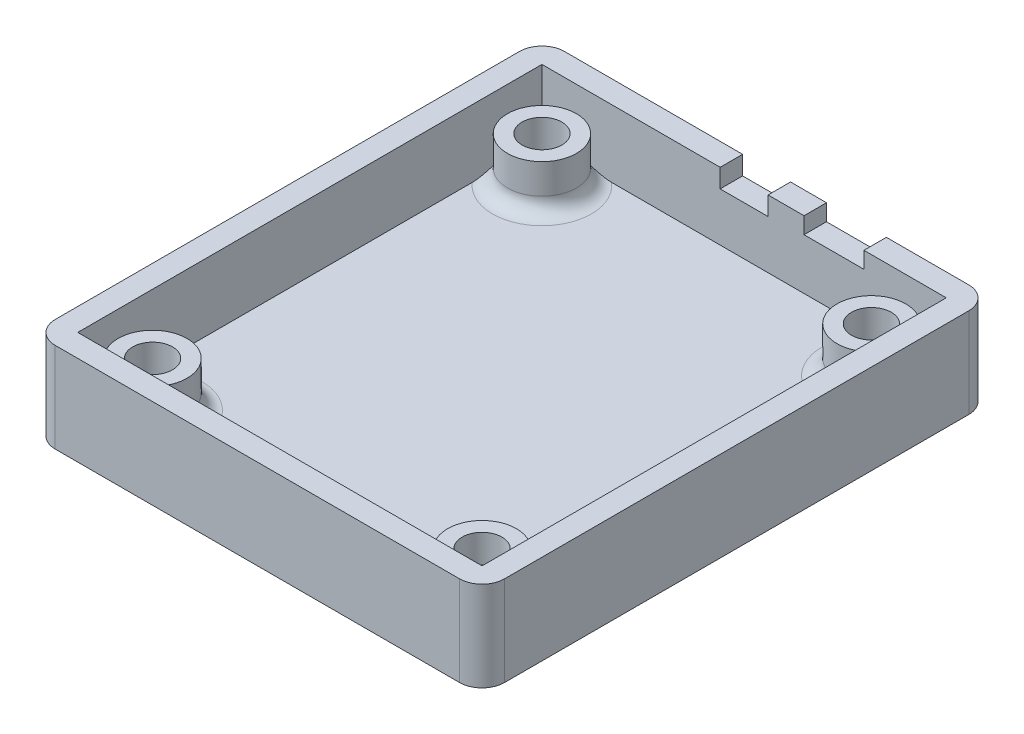
from build123d import *

# Parameters (mm, degrees)
SKETCH3_W                                           = 76.2
SKETCH3_H                                           = 86.36
BOSS_EXTRUDE2_DEPTH                                 = 15.24
SKETCH6_W                                           = 68.58
SKETCH6_H                                           = 78.74
CUT_EXTRUDE2_DEPTH                                  = 11.43
SKETCH7_R                                           = 5.842
SKETCH7_R_2                                         = 3.302
BOSS_EXTRUDE3_DEPTH                                 = 7.62
FILLET1_R                                           = 2.54
CSK_FOR_1_4_FLAT_HEAD_MACHINE_SCREW_100_D           = 6.7564
CSK_FOR_1_4_FLAT_HEAD_MACHINE_SCREW_100_DEPTH       = 91.44
CSK_FOR_1_4_FLAT_HEAD_MACHINE_SCREW_100_CSINK_D     = 12.8778
CSK_FOR_1_4_FLAT_HEAD_MACHINE_SCREW_100_CSINK_ANGLE = 100
CSK_FOR_1_4_FLAT_HEAD_MACHINE_SCREW_100_TIP         = 2.029827343
CUT_EXTRUDE4_REACH                                  = 118.176
SKETCH11_W                                          = 8.128
SKETCH11_H                                          = 3.175
CUT_EXTRUDE5_REACH                                  = 118.176
SKETCH12_W                                          = 10.16
SKETCH12_H                                          = 2.794
FILLET2_R                                           = 3.81


with BuildPart() as part:
    # Sketch3 → Boss-Extrude2 (new body)
    with BuildSketch(Plane(origin=(0, 0, 0), x_dir=(1, 0, 0), z_dir=(0, 1, 0))):
        with Locations((38.1, 43.18)):
            Rectangle(SKETCH3_W, SKETCH3_H)
    extrude(amount=BOSS_EXTRUDE2_DEPTH)

    # Sketch6 → Cut-Extrude2 (cut)
    with BuildSketch(Plane(origin=(0, 15.24, 0), x_dir=(1, 0, 0), z_dir=(0, 1, 0))):
        with Locations((38.1, 43.18)):
            Rectangle(SKETCH6_W, SKETCH6_H)
    extrude(amount=-CUT_EXTRUDE2_DEPTH, mode=Mode.SUBTRACT)

    # Sketch7 → Boss-Extrude3 (add)
    # profile 1 of 4: a face of its own
    with BuildSketch(Plane(origin=(0, 3.81, 0), x_dir=(1, 0, 0), z_dir=(0, 1, 0))):
        with Locations(Location((10.16, 76.2, 0), (0, 0, 90))):
            Circle(SKETCH7_R)
        with Locations(Location((10.16, 76.2, 0), (0, 0, 90))):
            Circle(SKETCH7_R_2, mode=Mode.SUBTRACT)
    # profile 2 of 4: a face of its own
    with BuildSketch(Plane(origin=(0, 3.81, 0), x_dir=(1, 0, 0), z_dir=(0, 1, 0))):
        with Locations(Location((66.04, 76.2, 0), (0, 0, 90))):
            Circle(SKETCH7_R)
        with Locations(Location((66.04, 76.2, 0), (0, 0, 90))):
            Circle(SKETCH7_R_2, mode=Mode.SUBTRACT)
    # profile 3 of 4: a face of its own
    with BuildSketch(Plane(origin=(0, 3.81, 0), x_dir=(1, 0, 0), z_dir=(0, 1, 0))):
        with Locations(Location((10.16, 10.16, 0), (0, 0, 90))):
            Circle(SKETCH7_R)
        with Locations(Location((10.16, 10.16, 0), (0, 0, 90))):
            Circle(SKETCH7_R_2, mode=Mode.SUBTRACT)
    # profile 4 of 4: a face of its own
    with BuildSketch(Plane(origin=(0, 3.81, 0), x_dir=(1, 0, 0), z_dir=(0, 1, 0))):
        with Locations(Location((66.04, 10.16, 0), (0, 0, 90))):
            Circle(SKETCH7_R)
        with Locations(Location((66.04, 10.16, 0), (0, 0, 90))):
            Circle(SKETCH7_R_2, mode=Mode.SUBTRACT)
    extrude(amount=BOSS_EXTRUDE3_DEPTH)

    # Fillet1
    # the kernel refuses this fillet: 2.54 mm, written as the material it adds along each edge
    with BuildSketch(Plane(origin=(10.16, 3.81, -76.2), x_dir=(0, 0, -1), z_dir=(1, 0, 0))) as fillet1_piece_1:
        with BuildLine():
            CenterArc((5.842 + FILLET1_R, FILLET1_R), FILLET1_R, 180, 90)
            Line((5.842, FILLET1_R), (5.842, 0))
            Line((5.842, 0), (5.842 + FILLET1_R, 0))
        make_face()
    revolve(axis=Axis((10.16, 3.81, -76.2), (0, 1, 0)))
    with BuildSketch(Plane(origin=(66.04, 3.81, -76.2), x_dir=(0, 0, -1), z_dir=(1, 0, 0))) as fillet1_piece_2:
        with BuildLine():
            CenterArc((5.842 + FILLET1_R, FILLET1_R), FILLET1_R, 180, 90)
            Line((5.842, FILLET1_R), (5.842, 0))
            Line((5.842, 0), (5.842 + FILLET1_R, 0))
        make_face()
    revolve(axis=Axis((66.04, 3.81, -76.2), (0, 1, 0)))
    with BuildSketch(Plane(origin=(10.16, 3.81, -10.16), x_dir=(0, 0, -1), z_dir=(1, 0, 0))) as fillet1_piece_3:
        with BuildLine():
            CenterArc((5.842 + FILLET1_R, FILLET1_R), FILLET1_R, 180, 90)
            Line((5.842, FILLET1_R), (5.842, 0))
            Line((5.842, 0), (5.842 + FILLET1_R, 0))
        make_face()
    revolve(axis=Axis((10.16, 3.81, -10.16), (0, 1, 0)))
    with BuildSketch(Plane(origin=(66.04, 3.81, -10.16), x_dir=(0, 0, -1), z_dir=(1, 0, 0))) as fillet1_piece_4:
        with BuildLine():
            CenterArc((5.842 + FILLET1_R, FILLET1_R), FILLET1_R, 180, 90)
            Line((5.842, FILLET1_R), (5.842, 0))
            Line((5.842, 0), (5.842 + FILLET1_R, 0))
        make_face()
    revolve(axis=Axis((66.04, 3.81, -10.16), (0, 1, 0)))

    # CSK for 1/4 Flat Head Machine Screw (100)1
    with Locations(Plane(origin=(0, 0, 0), x_dir=(-1, 0, 0), z_dir=(0, -1, 0))):
        with Locations((-10.16, 10.16), (-66.04, 10.16), (-66.04, 76.2), (-10.16, 76.2)):
            CounterSinkHole(CSK_FOR_1_4_FLAT_HEAD_MACHINE_SCREW_100_D / 2, CSK_FOR_1_4_FLAT_HEAD_MACHINE_SCREW_100_CSINK_D / 2, depth=CSK_FOR_1_4_FLAT_HEAD_MACHINE_SCREW_100_DEPTH, counter_sink_angle=CSK_FOR_1_4_FLAT_HEAD_MACHINE_SCREW_100_CSINK_ANGLE)
            with Locations((0, 0, -(CSK_FOR_1_4_FLAT_HEAD_MACHINE_SCREW_100_DEPTH + CSK_FOR_1_4_FLAT_HEAD_MACHINE_SCREW_100_TIP / 2))):  # 118° drill point
                Cone(0, CSK_FOR_1_4_FLAT_HEAD_MACHINE_SCREW_100_D / 2, CSK_FOR_1_4_FLAT_HEAD_MACHINE_SCREW_100_TIP, mode=Mode.SUBTRACT)

    # Sketch11 → Cut-Extrude4 (cut, up to next)
    with BuildSketch(Plane(origin=(0, 0, -86.36), x_dir=(-1, 0, 0), z_dir=(0, 0, -1)), mode=Mode.PRIVATE) as cut_extrude4_sk1:
        with Locations((-38.1, 13.6525)):
            Rectangle(SKETCH11_W, SKETCH11_H)
    cut_extrude4_tool1 = extrude(cut_extrude4_sk1.sketch, amount=-CUT_EXTRUDE4_REACH, mode=Mode.PRIVATE) & part.part
    add(cut_extrude4_tool1.solids().sort_by_distance((38.1, 13.6525, -86.36))[0], mode=Mode.SUBTRACT)

    # Sketch12 → Cut-Extrude5 (cut, up to next)
    with BuildSketch(Plane(origin=(0, 0, -86.36), x_dir=(-1, 0, 0), z_dir=(0, 0, -1)), mode=Mode.PRIVATE) as cut_extrude5_sk1:
        with Locations((-53.34, 13.843)):
            Rectangle(SKETCH12_W, SKETCH12_H)
    cut_extrude5_tool1 = extrude(cut_extrude5_sk1.sketch, amount=-CUT_EXTRUDE5_REACH, mode=Mode.PRIVATE) & part.part
    add(cut_extrude5_tool1.solids().sort_by_distance((53.34, 13.843, -86.36))[0], mode=Mode.SUBTRACT)

    # Fillet2
    fillet2_edges = [part.edges().sort_by_distance(p)[0] for p in [
        (0, 7.62, -86.36),
        (76.2, 7.62, -86.36),
        (76.2, 7.62, 0),
        (0, 7.62, 0),
    ]]
    fillet(fillet2_edges, radius=FILLET2_R)


solid = part.part
